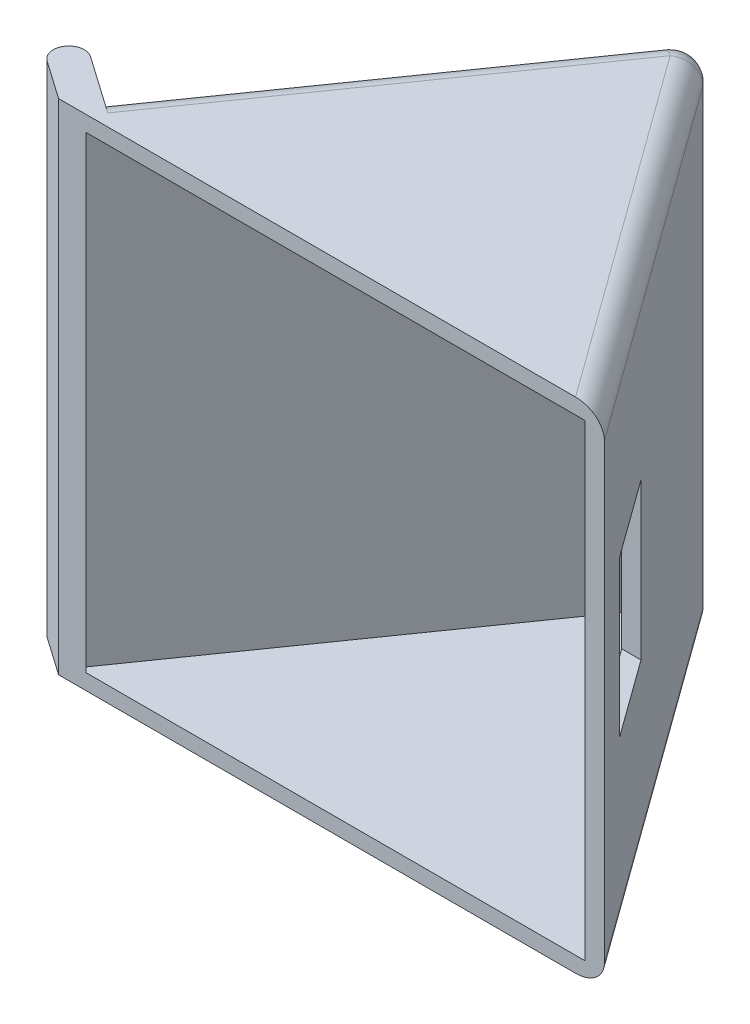
from build123d import *

# Parameters (mm, degrees)
EXTRUDE_1_DEPTH     = 32
EXTRUDE_2_DEPTH     = 32
CUT_EXTRUDE_1_DEPTH = 4
SHELL_START         = 1
SHELL_1_DEPTH       = 30
CUT_EXTRUDE_START   = 27.611157
SKETCH_4_W          = 5
SKETCH_4_H          = 10
CUT_EXTRUDE_2_DEPTH = 4.85474
CUT_EXTRUDE_3_REACH = 55.413
SKETCH_6_R          = 1
FILLET_1_R          = 1
FILLET_2_R          = 1
FILLET_3_R          = 1.5


# Read off the part's stored shape, not the designer's step: 抽壳1
with BuildPart() as part:
    # 草图1 → 凸台-拉伸1 (new body)
    with BuildSketch(Plane(origin=(0, 0, 0), x_dir=(1, 0, 0), z_dir=(0, 1, 0))):
        Polygon((0, 0), (35, 0), (17.207293091, 24.574561329), align=None)
    extrude(amount=EXTRUDE_1_DEPTH)

    # 草图2 → 凸台-拉伸2 (add)
    with BuildSketch(Plane(origin=(0, 0, 0), x_dir=(1, 0, 0), z_dir=(0, 1, 0))):
        Polygon((0, 0), (-3.276608177, 2.294305745), (-2.129455304, 3.932609834), (1.147152873, 1.638304089), align=None)
    extrude(amount=EXTRUDE_2_DEPTH)

    # 草图3 → 切除-拉伸1 (cut)
    with BuildSketch(Plane(origin=(-3.276608177, 0, -2.294305745), x_dir=(-0.5735764363510533, 0, 0.8191520442889868), z_dir=(-0.8191520442889868, 0, -0.5735764363510533))):
        with BuildLine():
            Line((-2, 17), (-2, 15))
            ThreePointArc((-2, 15), (-1, 16), (-2, 17))
        make_face()
    extrude(amount=-CUT_EXTRUDE_1_DEPTH, mode=Mode.SUBTRACT)

    # 抽壳1 outline → 抽壳1 (cut)
    with BuildSketch(Plane(origin=(0, 0, 0), x_dir=(1, 0, 0), z_dir=(0, 1, 0)).offset(SHELL_START)):
        Polygon((1.392728481, 0.245575608), (1.743446796, 0), (33.76540748, 0), (17.220918494, 22.850573626), align=None)
    extrude(amount=SHELL_1_DEPTH, mode=Mode.SUBTRACT)

    # 草图4 → 切除-拉伸2 (cut)
    with BuildSketch(Plane(origin=(0, 0, 0), x_dir=(0, 0, -1), z_dir=(1, 0, 0)).offset(CUT_EXTRUDE_START)):
        with Locations((6, 16)):
            Rectangle(SKETCH_4_W, SKETCH_4_H)
    extrude(amount=CUT_EXTRUDE_2_DEPTH, mode=Mode.SUBTRACT)

    # 草图6 → 切除-拉伸3 (cut, up to next)
    with BuildSketch(Plane(origin=(0, 0, 0), x_dir=(-0.5735764363510502, 0, 0.819152044288989), z_dir=(-0.819152044288989, 0, -0.5735764363510502)), mode=Mode.PRIVATE) as cut_extrude_3_sk1:
        with Locations((-26, 16)):
            Circle(SKETCH_6_R)
    cut_extrude_3_tool1 = extrude(cut_extrude_3_sk1.sketch, amount=-CUT_EXTRUDE_3_REACH, mode=Mode.PRIVATE) & part.part
    add(cut_extrude_3_tool1.solids().sort_by_distance((14.912987, 16, -21.297953))[0], mode=Mode.SUBTRACT)

    # 圆角1
    fillet_1_edges = [part.edges().sort_by_distance(p)[0] for p in [
        (-2.129455304, 24.5, -3.932609834),
        (-2.129455304, 7.5, -3.932609834),
    ]]
    fillet(fillet_1_edges, radius=FILLET_1_R - 0.0001)  # a hair under: the kernel refuses the full size

    # 圆角2
    fillet_2_edges = [part.edges().sort_by_distance(p)[0] for p in [
        (-3.276608177, 16, -2.294305745),
    ]]
    fillet(fillet_2_edges, radius=FILLET_2_R - 0.0001)  # a hair under: the kernel refuses the full size

    # 圆角3
    fillet_3_edges = [part.edges().sort_by_distance(p)[0] for p in [
        (26.103646545, 32, -12.287280664),
        (26.103646545, 0, -12.287280664),
        (9.177222982, 32, -13.106432709),
        (9.177222982, 0, -13.106432709),
        (17.207293091, 16, -24.574561329),
    ]]
    fillet(fillet_3_edges, radius=FILLET_3_R)


solid = part.part
